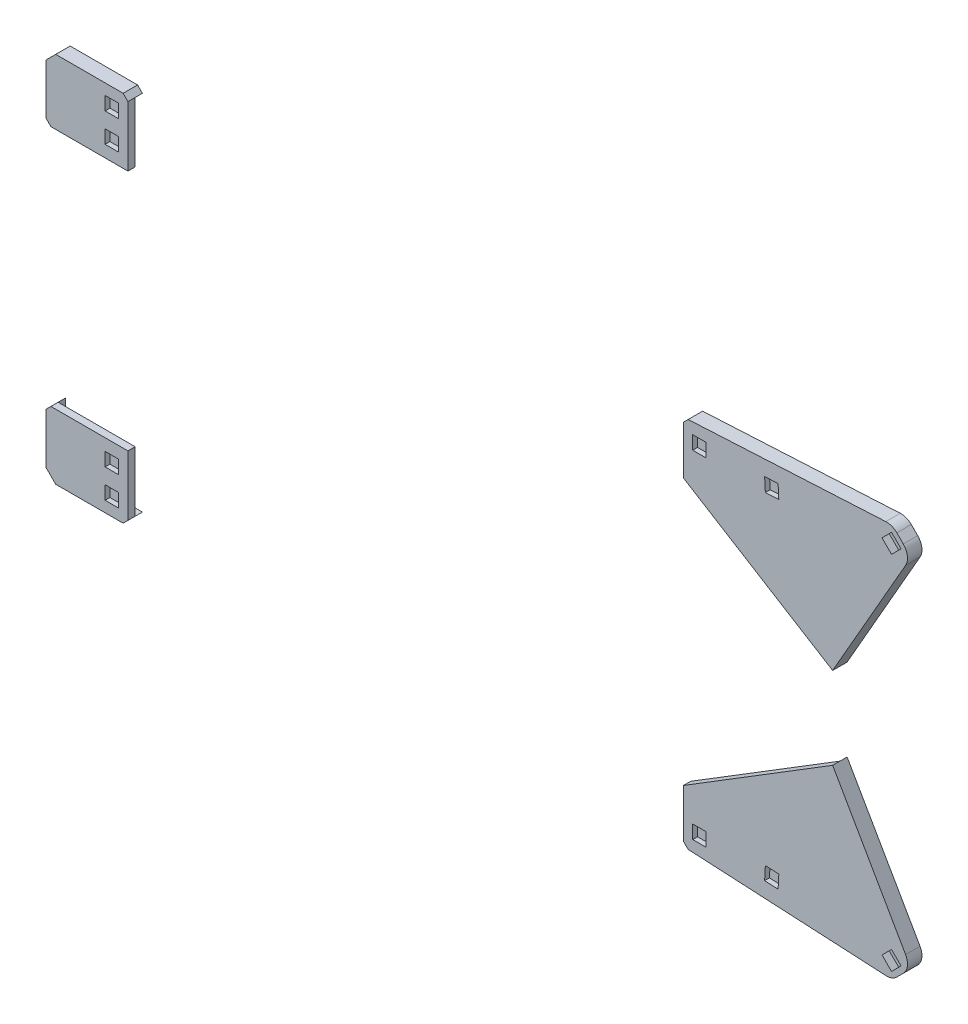
from build123d import *

# Parameters (mm, degrees)
SKETCH1_R                   = 1.5
BOSS_EXTRUDE1_DEPTH         = 3
BOSS_EXTRUDE2_OUTLINE_R     = 1.75
BOSS_EXTRUDE2_OUTLINE_R_2   = 1.5
BOSS_EXTRUDE2_DEPTH         = 3
BOSS_EXTRUDE2_2_OUTLINE_R   = 1.75
BOSS_EXTRUDE2_2_OUTLINE_R_2 = 1.5
BOSS_EXTRUDE2_2_DEPTH       = 3
SKETCH2_W                   = 5.6
SKETCH2_H                   = 5.6
CUT_EXTRUDE3_DEPTH          = 2
SKETCH3_R                   = 1.75
BOSS_EXTRUDE3_DEPTH         = 3
BOSS_EXTRUDE4_DEPTH         = 3
CHAMFER1_SIZE               = 4
CHAMFER2_SIZE               = 4
CUT_EXTRUDE4_DEPTH          = 1
SKETCH5_W                   = 5.6
SKETCH5_H                   = 5.6
CUT_EXTRUDE5_DEPTH          = 2
BOSS_EXTRUDE5_START         = -0.3
SKETCH6_R                   = 1.75
BOSS_EXTRUDE5_DEPTH         = 0.3
SKETCH7_R                   = 1.5
BOSS_EXTRUDE6_DEPTH         = 0.3


# Read off the part's stored shape, not the designer's step: Boss-Extrude2
with BuildPart() as part:
    # Sketch1 → Boss-Extrude1 (new body)
    # profile 1 of 4: a face of its own
    with BuildSketch(Plane.XY):
        with BuildLine():
            Line((229.79564609, 5.502306365), (199.510489142, 58.42891882))
            Line((199.510489142, 58.42891882), (199.510489142, 5.762730679))
            Line((199.510489142, 5.762730679), (218.9389204, -5.354419326))
            ThreePointArc((218.9389204, -5.354419326), (220.225257958, -5.902741482), (221.603580618, -6.13842803))
            ThreePointArc((221.603580618, -6.13842803), (224.068457171, -5.7484178), (226.161463425, -4.389355907))
            Line((226.161463425, -4.389355907), (228.830582671, -1.72023666))
            ThreePointArc((228.830582671, -1.72023666), (230.535087191, 1.727757007), (229.79564609, 5.502306365))
        make_face()
        with Locations((223.960489142, 0.480737622)):
            Circle(SKETCH1_R, mode=Mode.SUBTRACT)
    # profile 2 of 4: a face of its own
    with BuildSketch(Plane.XY):
        with BuildLine():
            Line((199.510489142, 145.198744566), (199.510489142, 92.532556425))
            Line((199.510489142, 92.532556425), (229.79564609, 145.45916888))
            ThreePointArc((229.79564609, 145.45916888), (230.535087191, 149.233718237), (228.830582671, 152.681711905))
            Line((228.830582671, 152.681711905), (226.161463425, 155.350831151))
            ThreePointArc((226.161463425, 155.350831151), (224.068457171, 156.709893045), (221.603580618, 157.099903275))
            ThreePointArc((221.603580618, 157.099903275), (220.225257958, 156.864216727), (218.9389204, 156.31589457))
            Line((218.9389204, 156.31589457), (199.510489142, 145.198744566))
        make_face()
        with Locations((223.960489142, 150.480737622)):
            Circle(SKETCH1_R, mode=Mode.SUBTRACT)
    # profile 3 of 4: a face of its own
    with BuildSketch(Plane.XY):
        with BuildLine():
            Line((218.9389204, -5.354419326), (199.510489142, 5.762730679))
            Line((199.510489142, 5.762730679), (199.510489142, 5.480737623))
            ThreePointArc((199.510489142, 5.480737623), (197.958155082, 1.733071682), (194.210489142, 0.180737622))
            Line((194.210489142, 0.180737622), (137.510489142, 0.180737622))
            Line((137.510489142, 0.180737623), (139.510489142, -1.819262377))
            Line((139.510489142, -1.819262377), (221.603580618, -6.13842803))
            ThreePointArc((221.603580618, -6.13842803), (220.225257958, -5.902741482), (218.9389204, -5.354419326))
        make_face()
    # profile 4 of 4: a face of its own
    with BuildSketch(Plane.XY):
        with BuildLine():
            Line((199.510489142, 145.480737623), (199.510489142, 145.198744566))
            Line((199.510489142, 145.198744566), (218.9389204, 156.31589457))
            ThreePointArc((218.9389204, 156.31589457), (220.225257958, 156.864216727), (221.603580618, 157.099903275))
            Line((221.603580618, 157.099903275), (139.510489142, 152.780737622))
            Line((139.510489142, 152.780737622), (137.510489142, 150.780737622))
            Line((137.510489142, 150.780737622), (194.210489141, 150.780737622))
            ThreePointArc((194.210489141, 150.780737622), (197.958155082, 149.228403563), (199.510489142, 145.480737623))
        make_face()
    extrude(amount=-BOSS_EXTRUDE1_DEPTH)

    # Boss-Extrude2 outline → Boss-Extrude2 (add)
    with BuildSketch(Plane.XY):
        with BuildLine():
            Line((228.830582671, 152.681711905), (226.161463425, 155.350831151))
            ThreePointArc((226.161463425, 155.350831151), (224.068457172, 156.709893045), (221.603580618, 157.099903275))
            Line((221.603580618, 157.099903275), (139.510489142, 152.780737622))
            Line((139.510489142, 152.780737622), (137.510489142, 150.780737622))
            Line((137.510489142, 150.780737622), (137.510489142, 130.780737622))
            Line((137.510489142, 130.780737622), (199.510489142, 92.532556425))
            Line((199.510489142, 92.532556425), (229.79564609, 145.45916888))
            ThreePointArc((229.79564609, 145.45916888), (230.535087191, 149.233718237), (228.830582671, 152.681711905))
        make_face()
        with Locations((144.210489142, 145.480737622)):
            Circle(BOSS_EXTRUDE2_OUTLINE_R, mode=Mode.SUBTRACT)
        with Locations((174.210489142, 145.480737622)):
            Circle(BOSS_EXTRUDE2_OUTLINE_R, mode=Mode.SUBTRACT)
        with Locations((223.960489142, 150.480737622)):
            Circle(BOSS_EXTRUDE2_OUTLINE_R_2, mode=Mode.SUBTRACT)
    extrude(amount=BOSS_EXTRUDE2_DEPTH)


with BuildPart() as body_2:
    # Boss-Extrude2 2 outline → Boss-Extrude2 2 (new body)
    with BuildSketch(Plane.XY):
        with BuildLine():
            Line((199.510489142, 58.42891882), (137.510489142, 20.180737623))
            Line((137.510489142, 20.180737623), (137.510489142, 0.180737622))
            Line((137.510489142, 0.180737622), (139.510489142, -1.819262377))
            Line((139.510489142, -1.819262377), (221.603580618, -6.13842803))
            ThreePointArc((221.603580618, -6.13842803), (224.068457172, -5.7484178), (226.161463425, -4.389355907))
            Line((226.161463425, -4.389355907), (228.830582671, -1.72023666))
            ThreePointArc((228.830582671, -1.72023666), (230.535087191, 1.727757008), (229.79564609, 5.502306365))
            Line((229.79564609, 5.502306365), (199.510489142, 58.42891882))
        make_face()
        with Locations((144.210489142, 5.480737622)):
            Circle(BOSS_EXTRUDE2_2_OUTLINE_R, mode=Mode.SUBTRACT)
        with Locations((174.210489142, 5.480737622)):
            Circle(BOSS_EXTRUDE2_2_OUTLINE_R, mode=Mode.SUBTRACT)
        with Locations((223.960489142, 0.480737622)):
            Circle(BOSS_EXTRUDE2_2_OUTLINE_R_2, mode=Mode.SUBTRACT)
    extrude(amount=BOSS_EXTRUDE2_2_DEPTH)


with BuildPart() as cut_extrude3_tool:
    # Sketch2 → Cut-Extrude3 (new body)
    with BuildSketch(Plane(origin=(0, 0, 3), x_dir=(-1, 0, 0), z_dir=(0, 0, -1))):
        Polygon((-177.153734776, 142.831717967), (-176.859508797, 148.423983257), (-171.267243507, 148.129757278), (-171.561469486, 142.537491988), align=None)
        with Locations((-144.210489142, 145.480737622)):
            Rectangle(SKETCH2_W, SKETCH2_H)
        Polygon((-227.920287116, 150.480737622), (-223.960489142, 146.520939648), (-220.000691167, 150.480737622), (-223.960489142, 154.440535597), align=None)
        Polygon((-227.920287116, 0.480737622), (-223.960489142, -3.479060352), (-220.000691167, 0.480737622), (-223.960489142, 4.440535597), align=None)
        Polygon((-177.153734776, 8.129757278), (-176.859508797, 2.537491988), (-171.267243507, 2.831717967), (-171.561469486, 8.423983257), align=None)
        with Locations((-144.210489142, 5.480737622)):
            Rectangle(SKETCH2_W, SKETCH2_H)
    extrude(amount=CUT_EXTRUDE3_DEPTH)


with BuildPart() as part_1:
    add(part.part)

    # Cut-Extrude3: cut by cut_extrude3_tool
    add(cut_extrude3_tool.part, mode=Mode.SUBTRACT)


with BuildPart() as body_2_1:
    add(body_2.part)

    # Cut-Extrude3: cut by cut_extrude3_tool
    add(cut_extrude3_tool.part, mode=Mode.SUBTRACT)


with BuildPart() as part_2:
    add(part_1.part)

    # Combine1: union body 2
    add(body_2_1.part)

    # Sketch4 → Cut-Extrude4 (cut)
    with BuildSketch(Plane.XY.offset(1)):
        Polygon((227.920287116, 0.480737622), (223.960489142, 4.440535597), (220.000691167, 0.480737622), (223.960489142, -3.479060352), align=None)
        Polygon((227.920287116, 150.480737622), (223.960489142, 154.440535597), (220.000691167, 150.480737622), (223.960489142, 146.520939648), align=None)
    extrude(amount=-CUT_EXTRUDE4_DEPTH, mode=Mode.SUBTRACT)



with BuildPart() as body_2_2:
    # Sketch3 → Boss-Extrude3 (new body)
    # profile 1 of 4: a face of its own
    with BuildSketch(Plane.XY):
        with BuildLine():
            Line((-93.089510858, 25.180737622), (-125.089510858, 25.180737622))
            Line((-125.089510858, 25.180737622), (-125.089510858, 5.480737622))
            ThreePointArc((-125.089510858, 5.480737622), (-123.537176799, 1.733071682), (-119.789510858, 0.180737622))
            Line((-119.789510858, 0.180737622), (-93.089510858, 0.180737622))
            Line((-93.089510858, 0.180737622), (-93.089510858, 25.180737622))
        make_face()
        with Locations((-99.789510858, 5.480737622)):
            Circle(SKETCH3_R, mode=Mode.SUBTRACT)
        with Locations((-99.789510858, 17.480737622)):
            Circle(SKETCH3_R, mode=Mode.SUBTRACT)
    # profile 2 of 4: a face of its own
    with BuildSketch(Plane.XY):
        with BuildLine():
            Line((-125.089510858, 5.480737622), (-125.089510858, 25.180737622))
            Line((-125.089510858, 25.180737622), (-127.089510858, 23.180737622))
            Line((-127.089510858, 23.180737622), (-127.089510858, -1.819262378))
            Line((-127.089510858, -1.819262378), (-95.089510858, -1.819262378))
            Line((-95.089510858, -1.819262378), (-93.089510858, 0.180737622))
            Line((-93.089510858, 0.180737622), (-119.789510858, 0.180737622))
            ThreePointArc((-119.789510858, 0.180737622), (-123.537176799, 1.733071682), (-125.089510858, 5.480737622))
        make_face()
    # profile 3 of 4: a face of its own
    with BuildSketch(Plane.XY):
        with BuildLine():
            Line((-125.089510858, 145.480737622), (-125.089510858, 125.780737622))
            Line((-125.089510858, 125.780737622), (-93.089510858, 125.780737622))
            Line((-93.089510858, 125.780737622), (-93.089510858, 150.780737622))
            Line((-93.089510858, 150.780737622), (-119.789510858, 150.780737622))
            ThreePointArc((-119.789510858, 150.780737622), (-123.537176799, 149.228403563), (-125.089510858, 145.480737622))
        make_face()
        with Locations((-99.789510858, 133.480737622)):
            Circle(SKETCH3_R, mode=Mode.SUBTRACT)
        with Locations((-99.789510858, 145.480737622)):
            Circle(SKETCH3_R, mode=Mode.SUBTRACT)
    # profile 4 of 4: a face of its own
    with BuildSketch(Plane.XY):
        with BuildLine():
            Line((-127.089510858, 127.780737622), (-125.089510858, 125.780737622))
            Line((-125.089510858, 125.780737622), (-125.089510858, 145.480737622))
            ThreePointArc((-125.089510858, 145.480737622), (-123.537176799, 149.228403563), (-119.789510858, 150.780737622))
            Line((-119.789510858, 150.780737622), (-93.089510858, 150.780737622))
            Line((-93.089510858, 150.780737622), (-95.089510858, 152.780737622))
            Line((-95.089510858, 152.780737622), (-127.089510858, 152.780737622))
            Line((-127.089510858, 152.780737622), (-127.089510858, 127.780737622))
        make_face()
    extrude(amount=BOSS_EXTRUDE3_DEPTH)

    # Sketch3<3> → Boss-Extrude4 (add)
    with BuildSketch(Plane.XY):
        with BuildLine():
            Line((-125.089510858, 5.480737622), (-125.089510858, 25.180737622))
            Line((-125.089510858, 25.180737622), (-127.089510858, 23.180737622))
            Line((-127.089510858, 23.180737622), (-127.089510858, -1.819262378))
            Line((-127.089510858, -1.819262378), (-95.089510858, -1.819262378))
            Line((-95.089510858, -1.819262378), (-93.089510858, 0.180737622))
            Line((-93.089510858, 0.180737622), (-119.789510858, 0.180737622))
            ThreePointArc((-119.789510858, 0.180737622), (-123.537176799, 1.733071682), (-125.089510858, 5.480737622))
        make_face()
        with BuildLine():
            Line((-127.089510858, 127.780737622), (-125.089510858, 125.780737622))
            Line((-125.089510858, 125.780737622), (-125.089510858, 145.480737622))
            ThreePointArc((-125.089510858, 145.480737622), (-123.537176799, 149.228403563), (-119.789510858, 150.780737622))
            Line((-119.789510858, 150.780737622), (-93.089510858, 150.780737622))
            Line((-93.089510858, 150.780737622), (-95.089510858, 152.780737622))
            Line((-95.089510858, 152.780737622), (-127.089510858, 152.780737622))
            Line((-127.089510858, 152.780737622), (-127.089510858, 127.780737622))
        make_face()
    extrude(amount=-BOSS_EXTRUDE4_DEPTH)

    # Chamfer1
    chamfer1_edges = [body_2_2.edges().sort_by_distance(p)[0] for p in [
        (-127.089510858, 152.780737622, 0),
    ]]
    chamfer(chamfer1_edges, length=CHAMFER1_SIZE)

    # Chamfer2
    chamfer2_edges = [body_2_2.edges().sort_by_distance(p)[0] for p in [
        (-127.089510858, -1.819262378, 0),
    ]]
    chamfer(chamfer2_edges, length=CHAMFER2_SIZE)

    # Sketch5 → Cut-Extrude5 (cut)
    with BuildSketch(Plane.XY.offset(3)):
        with Locations((-99.789510858, 145.480737622)):
            Rectangle(SKETCH5_W, SKETCH5_H)
        with Locations((-99.789510858, 133.480737622)):
            Rectangle(SKETCH5_W, SKETCH5_H)
        with Locations((-99.789510858, 17.480737622)):
            Rectangle(SKETCH5_W, SKETCH5_H)
        with Locations((-99.789510858, 5.480737622)):
            Rectangle(SKETCH5_W, SKETCH5_H)
    extrude(amount=-CUT_EXTRUDE5_DEPTH, mode=Mode.SUBTRACT)


with BuildPart() as part_3:
    add(part_2.part)

    add(body_2_2.part)  # Boss-Extrude5 merges body 2 2
    # Sketch6 → Boss-Extrude5 (add)
    with BuildSketch(Plane.XY.offset(1).offset(BOSS_EXTRUDE5_START)):
        with Locations((-99.789510858, 145.480737622)):
            Circle(SKETCH6_R)
        with Locations((-99.789510858, 133.480737622)):
            Circle(SKETCH6_R)
        with Locations((-99.789510858, 17.480737622)):
            Circle(SKETCH6_R)
        with Locations((-99.789510858, 5.480737622)):
            Circle(SKETCH6_R)
        with Locations((144.210489142, 145.480737622)):
            Circle(SKETCH6_R)
        with Locations((174.210489142, 145.480737622)):
            Circle(SKETCH6_R)
        with Locations((144.210489142, 5.480737622)):
            Circle(SKETCH6_R)
        with Locations((174.210489142, 5.480737622)):
            Circle(SKETCH6_R)
    extrude(amount=BOSS_EXTRUDE5_DEPTH)

    # Sketch7 → Boss-Extrude6 (add)
    with BuildSketch(Plane.XY):
        with Locations((223.960489142, 0.480737622)):
            Circle(SKETCH7_R)
        with Locations((223.960489142, 150.480737622)):
            Circle(SKETCH7_R)
    extrude(amount=-BOSS_EXTRUDE6_DEPTH)


solid = part_3.part
